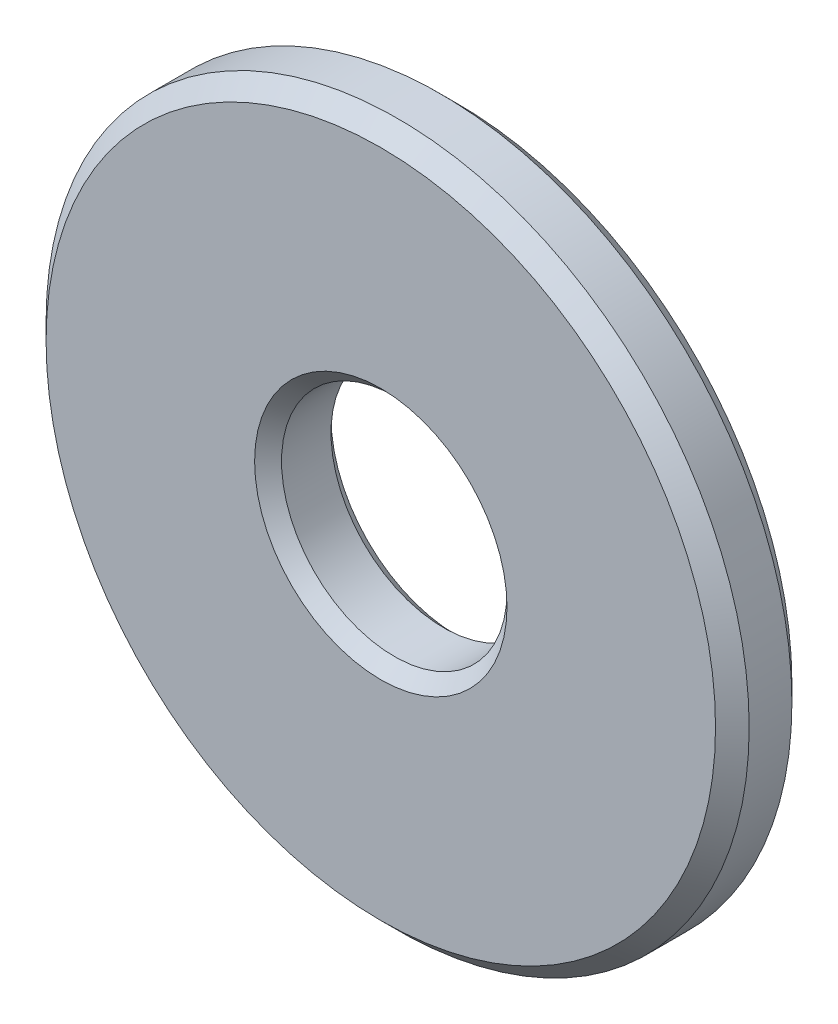
from build123d import *

# Parameters (mm, degrees)
SKETCH2_R           = 26.533992322
BOSS_EXTRUDE1_DEPTH = 5.7658
CHAMFER1_SIZE       = 1.27
SKETCH3_R           = 8.509
CUT_EXTRUDE1_DEPTH  = 5.7658
CHAMFER2_SIZE       = 1.016


with BuildPart() as part:
    # Sketch2 → Boss-Extrude1 (new body)
    with BuildSketch(Plane.XY):
        Circle(SKETCH2_R)
    extrude(amount=BOSS_EXTRUDE1_DEPTH)

    # Chamfer1
    chamfer1_edges = [part.edges().sort_by_distance(p)[0] for p in [
        (-26.533992322, 0, 0),
        (-26.533992322, 0, 5.7658),
    ]]
    chamfer(chamfer1_edges, length=CHAMFER1_SIZE)

    # Sketch3 → Cut-Extrude1 (cut)
    with BuildSketch(Plane.XY.offset(5.7658)):
        Circle(SKETCH3_R)
    extrude(amount=-CUT_EXTRUDE1_DEPTH, mode=Mode.SUBTRACT)

    # Chamfer2
    chamfer2_edges = [part.edges().sort_by_distance(p)[0] for p in [
        (-8.509, 0, 0),
        (-8.509, 0, 5.7658),
    ]]
    chamfer(chamfer2_edges, length=CHAMFER2_SIZE)


solid = part.part
